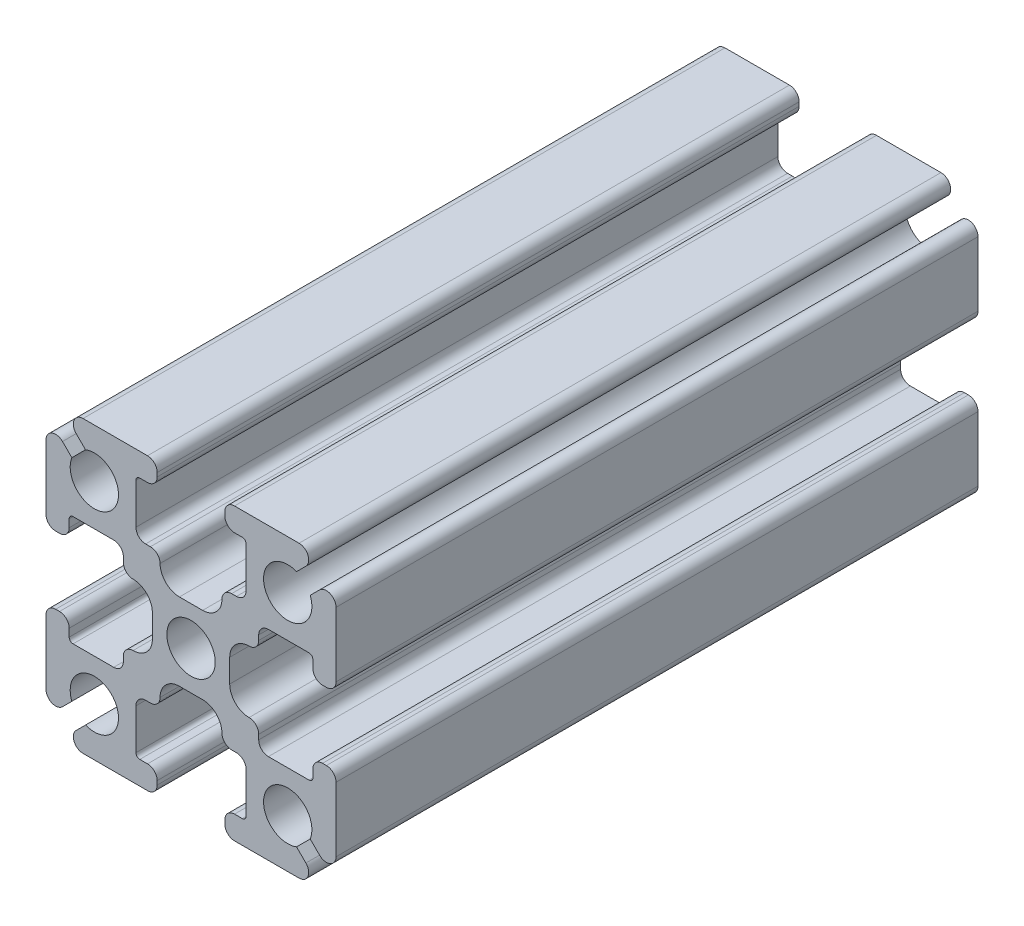
from build123d import *

# Parameters (mm, degrees)
SKETCH1_R           = 1.25
BOSS_EXTRUDE1_DEPTH = 33.197360358


with BuildPart() as part:
    # Sketch1 → Boss-Extrude1 (new body)
    with BuildSketch(Plane.XY):
        with BuildLine():
            Line((6.646446609, 5.939339828), (6.163645978, 5.456539197))
            ThreePointArc((6.163645978, 5.456539197), (4.116116524, 4.116116524), (5.456539197, 6.163645978))
            Line((5.456539197, 6.163645978), (5.939339828, 6.646446609))
            ThreePointArc((5.939339828, 6.646446609), (6.047726204, 7.191341716), (5.585786438, 7.5))
            Line((5.585786438, 7.5), (2.25, 7.5))
            ThreePointArc((2.25, 7.5), (1.896446609, 7.353553391), (1.75, 7))
            Line((1.75, 7), (1.75, 6.8))
            ThreePointArc((1.75, 6.8), (1.896446609, 6.446446609), (2.25, 6.3))
            Line((2.25, 6.3), (2.65, 6.3))
            ThreePointArc((2.65, 6.3), (2.791421356, 6.241421356), (2.85, 6.1))
            Line((2.85, 6.1), (2.85, 4))
            ThreePointArc((2.85, 4), (2.703553391, 3.646446609), (2.35, 3.5))
            Line((2.35, 3.5), (2.1, 3.5))
            ThreePointArc((2.1, 3.5), (1.746446609, 3.353553391), (1.6, 3))
            ThreePointArc((1.6, 3), (1.307106781, 2.292893219), (0.6, 2))
            Line((0.6, 2), (-0.6, 2))
            ThreePointArc((-0.6, 2), (-1.307106781, 2.292893219), (-1.6, 3))
            ThreePointArc((-1.6, 3), (-1.746446609, 3.353553391), (-2.1, 3.5))
            Line((-2.1, 3.5), (-2.35, 3.5))
            ThreePointArc((-2.35, 3.5), (-2.703553391, 3.646446609), (-2.85, 4))
            Line((-2.85, 4), (-2.85, 6.1))
            ThreePointArc((-2.85, 6.1), (-2.791421356, 6.241421356), (-2.65, 6.3))
            Line((-2.65, 6.3), (-2.25, 6.3))
            ThreePointArc((-2.25, 6.3), (-1.896446609, 6.446446609), (-1.75, 6.8))
            Line((-1.75, 6.8), (-1.75, 7))
            ThreePointArc((-1.75, 7), (-1.896446609, 7.353553391), (-2.25, 7.5))
            Line((-2.25, 7.5), (-5.585786438, 7.5))
            ThreePointArc((-5.585786438, 7.5), (-6.047726204, 7.191341716), (-5.939339828, 6.646446609))
            Line((-5.939339828, 6.646446609), (-5.456539197, 6.163645978))
            ThreePointArc((-5.456539197, 6.163645978), (-4.116116524, 4.116116524), (-6.163645978, 5.456539197))
            Line((-6.163645978, 5.456539197), (-6.646446609, 5.939339828))
            ThreePointArc((-6.646446609, 5.939339828), (-7.191341716, 6.047726204), (-7.5, 5.585786438))
            Line((-7.5, 5.585786438), (-7.5, 2.25))
            ThreePointArc((-7.5, 2.25), (-7.353553391, 1.896446609), (-7, 1.75))
            Line((-7, 1.75), (-6.8, 1.75))
            ThreePointArc((-6.8, 1.75), (-6.446446609, 1.896446609), (-6.3, 2.25))
            Line((-6.3, 2.25), (-6.3, 2.65))
            ThreePointArc((-6.3, 2.65), (-6.241421356, 2.791421356), (-6.1, 2.85))
            Line((-6.1, 2.85), (-4, 2.85))
            ThreePointArc((-4, 2.85), (-3.646446609, 2.703553391), (-3.5, 2.35))
            Line((-3.5, 2.35), (-3.5, 2.1))
            ThreePointArc((-3.5, 2.1), (-3.353553391, 1.746446609), (-3, 1.6))
            ThreePointArc((-3, 1.6), (-2.292893219, 1.307106781), (-2, 0.6))
            Line((-2, 0.6), (-2, -0.6))
            ThreePointArc((-2, -0.6), (-2.292893219, -1.307106781), (-3, -1.6))
            ThreePointArc((-3, -1.6), (-3.353553391, -1.746446609), (-3.5, -2.1))
            Line((-3.5, -2.1), (-3.5, -2.35))
            ThreePointArc((-3.5, -2.35), (-3.646446609, -2.703553391), (-4, -2.85))
            Line((-4, -2.85), (-6.1, -2.85))
            ThreePointArc((-6.1, -2.85), (-6.241421356, -2.791421356), (-6.3, -2.65))
            Line((-6.3, -2.65), (-6.3, -2.25))
            ThreePointArc((-6.3, -2.25), (-6.446446609, -1.896446609), (-6.8, -1.75))
            Line((-6.8, -1.75), (-7, -1.75))
            ThreePointArc((-7, -1.75), (-7.353553391, -1.896446609), (-7.5, -2.25))
            Line((-7.5, -2.25), (-7.5, -5.585786438))
            ThreePointArc((-7.5, -5.585786438), (-7.191341716, -6.047726204), (-6.646446609, -5.939339828))
            Line((-6.646446609, -5.939339828), (-6.163645978, -5.456539197))
            ThreePointArc((-6.163645978, -5.456539197), (-4.116116524, -4.116116524), (-5.456539197, -6.163645978))
            Line((-5.456539197, -6.163645978), (-5.939339828, -6.646446609))
            ThreePointArc((-5.939339828, -6.646446609), (-6.047726204, -7.191341716), (-5.585786438, -7.5))
            Line((-5.585786438, -7.5), (-2.25, -7.5))
            ThreePointArc((-2.25, -7.5), (-1.896446609, -7.353553391), (-1.75, -7))
            Line((-1.75, -7), (-1.75, -6.8))
            ThreePointArc((-1.75, -6.8), (-1.896446609, -6.446446609), (-2.25, -6.3))
            Line((-2.25, -6.3), (-2.65, -6.3))
            ThreePointArc((-2.65, -6.3), (-2.791421356, -6.241421356), (-2.85, -6.1))
            Line((-2.85, -6.1), (-2.85, -4))
            ThreePointArc((-2.85, -4), (-2.703553391, -3.646446609), (-2.35, -3.5))
            Line((-2.35, -3.5), (-2.1, -3.5))
            ThreePointArc((-2.1, -3.5), (-1.746446609, -3.353553391), (-1.6, -3))
            ThreePointArc((-1.6, -3), (-1.307106781, -2.292893219), (-0.6, -2))
            Line((-0.6, -2), (0.6, -2))
            ThreePointArc((0.6, -2), (1.307106781, -2.292893219), (1.6, -3))
            ThreePointArc((1.6, -3), (1.746446609, -3.353553391), (2.1, -3.5))
            Line((2.1, -3.5), (2.35, -3.5))
            ThreePointArc((2.35, -3.5), (2.703553391, -3.646446609), (2.85, -4))
            Line((2.85, -4), (2.85, -6.1))
            ThreePointArc((2.85, -6.1), (2.791421356, -6.241421356), (2.65, -6.3))
            Line((2.65, -6.3), (2.25, -6.3))
            ThreePointArc((2.25, -6.3), (1.896446609, -6.446446609), (1.75, -6.8))
            Line((1.75, -6.8), (1.75, -7))
            ThreePointArc((1.75, -7), (1.896446609, -7.353553391), (2.25, -7.5))
            Line((2.25, -7.5), (5.585786438, -7.5))
            ThreePointArc((5.585786438, -7.5), (6.047726204, -7.191341716), (5.939339828, -6.646446609))
            Line((5.939339828, -6.646446609), (5.456539197, -6.163645978))
            ThreePointArc((5.456539197, -6.163645978), (4.116116524, -4.116116524), (6.163645978, -5.456539197))
            Line((6.163645978, -5.456539197), (6.646446609, -5.939339828))
            ThreePointArc((6.646446609, -5.939339828), (7.191341716, -6.047726204), (7.5, -5.585786438))
            Line((7.5, -5.585786438), (7.5, -2.25))
            ThreePointArc((7.5, -2.25), (7.353553391, -1.896446609), (7, -1.75))
            Line((7, -1.75), (6.8, -1.75))
            ThreePointArc((6.8, -1.75), (6.446446609, -1.896446609), (6.3, -2.25))
            Line((6.3, -2.25), (6.3, -2.65))
            ThreePointArc((6.3, -2.65), (6.241421356, -2.791421356), (6.1, -2.85))
            Line((6.1, -2.85), (4, -2.85))
            ThreePointArc((4, -2.85), (3.646446609, -2.703553391), (3.5, -2.35))
            Line((3.5, -2.35), (3.5, -2.1))
            ThreePointArc((3.5, -2.1), (3.353553391, -1.746446609), (3, -1.6))
            ThreePointArc((3, -1.6), (2.292893219, -1.307106781), (2, -0.6))
            Line((2, -0.6), (2, 0.6))
            ThreePointArc((2, 0.6), (2.292893219, 1.307106781), (3, 1.6))
            ThreePointArc((3, 1.6), (3.353553391, 1.746446609), (3.5, 2.1))
            Line((3.5, 2.1), (3.5, 2.35))
            ThreePointArc((3.5, 2.35), (3.646446609, 2.703553391), (4, 2.85))
            Line((4, 2.85), (6.1, 2.85))
            ThreePointArc((6.1, 2.85), (6.241421356, 2.791421356), (6.3, 2.65))
            Line((6.3, 2.65), (6.3, 2.25))
            ThreePointArc((6.3, 2.25), (6.446446609, 1.896446609), (6.8, 1.75))
            Line((6.8, 1.75), (7, 1.75))
            ThreePointArc((7, 1.75), (7.353553391, 1.896446609), (7.5, 2.25))
            Line((7.5, 2.25), (7.5, 5.585786438))
            ThreePointArc((7.5, 5.585786438), (7.191341716, 6.047726204), (6.646446609, 5.939339828))
        make_face()
        Circle(SKETCH1_R, mode=Mode.SUBTRACT)
    extrude(amount=BOSS_EXTRUDE1_DEPTH)


solid = part.part
